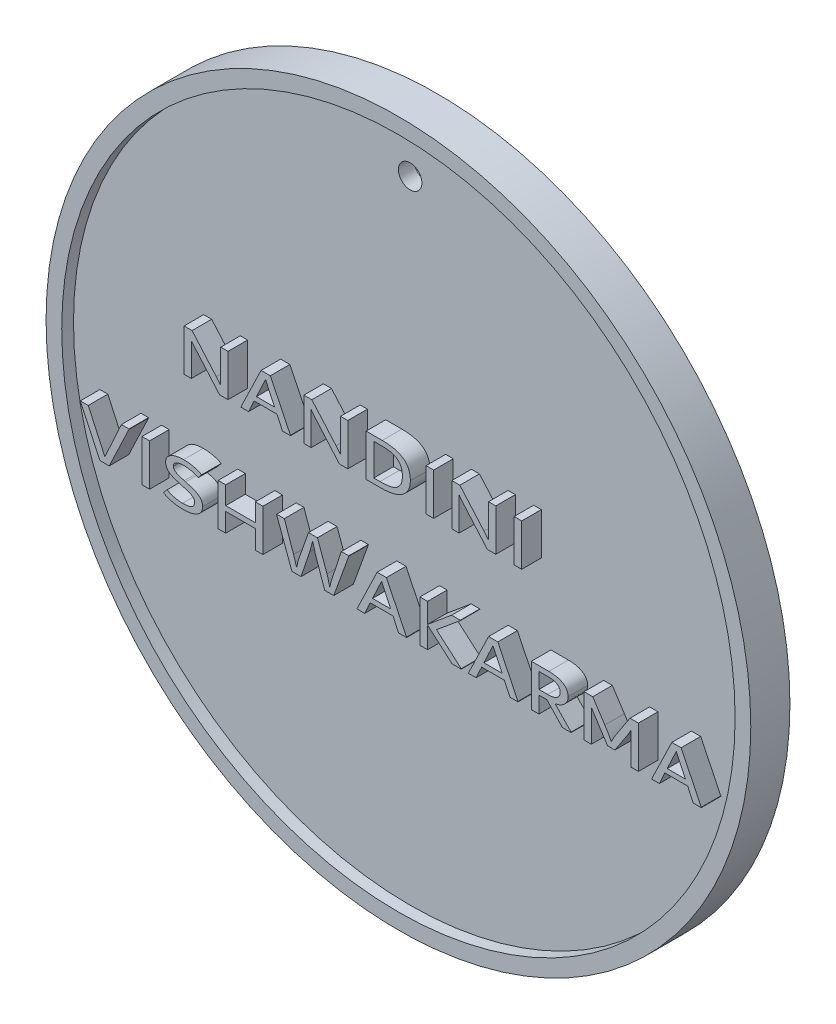
from build123d import *

# Parameters (mm, degrees)
SKETCH1_R           = 45
BOSS_EXTRUDE1_DEPTH = 5
SKETCH2_R           = 43
CUT_EXTRUDE1_DEPTH  = 1.5
CUT_EXTRUDE2_START  = -1.5
SKETCH3_R           = 43
CUT_EXTRUDE2_DEPTH  = 1.5
SKETCH4_R           = 1.5
CUT_EXTRUDE3_DEPTH  = 31.5
SKETCH5_W           = 0.970755601
SKETCH5_H           = 5.348111111
SKETCH5_W_2         = 0.9707556
BOSS_EXTRUDE2_DEPTH = 2.5
BOSS_EXTRUDE3_DEPTH = 2.5
BOSS_EXTRUDE4_DEPTH = 2.5
BOSS_EXTRUDE5_DEPTH = 2.5


with BuildPart() as part:
    # Sketch1 → Boss-Extrude1 (new body)
    with BuildSketch(Plane.XY):
        Circle(SKETCH1_R)
    extrude(amount=BOSS_EXTRUDE1_DEPTH)

    # Sketch2 → Cut-Extrude1 (cut)
    with BuildSketch(Plane.XY.offset(5)):
        Circle(SKETCH2_R)
    extrude(amount=-CUT_EXTRUDE1_DEPTH, mode=Mode.SUBTRACT)

    # Sketch3 → Cut-Extrude2 (cut)
    with BuildSketch(Plane(origin=(0, 0, 0), x_dir=(-1, 0, 0), z_dir=(0, 0, -1)).offset(CUT_EXTRUDE2_START)):
        Circle(SKETCH3_R)
    extrude(amount=CUT_EXTRUDE2_DEPTH, mode=Mode.SUBTRACT)

    # Sketch4 → Cut-Extrude3 (cut)
    with BuildSketch(Plane(origin=(0, 0, 1.5), x_dir=(-1, 0, 0), z_dir=(0, 0, -1))):
        with Locations((0, 37.626935334)):
            Circle(SKETCH4_R)
    extrude(amount=-CUT_EXTRUDE3_DEPTH, mode=Mode.SUBTRACT)

    # Sketch5 → Boss-Extrude2 (add)
    # profile 1 of 18: a face of its own
    with BuildSketch(Plane.XY.offset(3.5)):
        with BuildLine():
            Line((-20.764608658, 9.138884447), (-20.764608658, 3.790773336))
            Line((-20.764608658, 3.790773336), (-21.840439895, 3.790773336))
            Line((-21.840439895, 3.790773336), (-24.84584192, 7.257075313))
            Line((-24.84584192, 7.257075313), (-24.983156672, 7.413494727))
            add(Edge.make_bspline(
                [(-24.983156672, 7.413494727), (-24.98865352, 7.421115212), (-25.002589901, 7.440435737), (-25.030560579, 7.473510844), (-25.069033545, 7.518203573), (-25.134555766, 7.59022804), (-25.215384732, 7.685545356), (-25.304587629, 7.798099887), (-25.38115177, 7.906955024), (-25.425742143, 7.980413154), (-25.447638749, 8.016485598)],
                knots=[0, 0, 0, 0, 0.295690911, 0.749677205, 1.362566065, 2.152279745, 3.814274677, 5.295540138, 6.671944442, 8, 8, 8, 8], degree=3))
            Line((-25.447638749, 8.016485598), (-25.447638749, 3.790773336))
            Line((-25.447638749, 3.790773336), (-26.375408862, 3.790773336))
            Line((-26.375408862, 3.790773336), (-26.375408862, 9.138884447))
            Line((-26.375408862, 9.138884447), (-25.352115443, 9.138884447))
            Line((-25.352115443, 9.138884447), (-22.261936484, 5.598551908))
            add(Edge.make_bspline(
                [(-22.261936484, 5.598551908), (-22.252745791, 5.588235419), (-22.230603419, 5.563380761), (-22.192520328, 5.518391307), (-22.140873016, 5.462045386), (-22.061300057, 5.370533176), (-21.959102763, 5.257039796), (-21.854390292, 5.120625477), (-21.764227376, 4.99558865), (-21.715634088, 4.91158325), (-21.692378771, 4.871380738)],
                knots=[0, 0, 0, 0, 0.358216835, 0.863022034, 1.528040086, 2.33960324, 4.007384369, 5.485359271, 6.79656698, 8, 8, 8, 8], degree=3))
            Line((-21.692378771, 4.871380738), (-21.692378771, 9.138884447))
            Line((-21.692378771, 9.138884447), (-20.764608658, 9.138884447))
        make_face()
    # profile 2 of 18: a face of its own
    with BuildSketch(Plane.XY.offset(3.5)):
        Polygon((-15.361094029, 9.138884447), (-12.787934966, 3.83972903), (-12.787934966, 3.790773336), (-13.800482013, 3.790773336), (-14.518100851, 5.317952195), (-17.429173611, 5.317952195), (-18.134852036, 3.790773336), (-19.105607636, 3.790773336), (-19.105607636, 3.83972903), (-16.543194945, 9.138884447), align=None)
        Polygon((-17.133051361, 5.944823893), (-14.81302906, 5.944823893), (-15.973637231, 8.421265609), align=None, mode=Mode.SUBTRACT)
    # profile 3 of 18: a face of its own
    with BuildSketch(Plane.XY.offset(3.5)):
        with BuildLine():
            Line((-5.465595922, 9.138884447), (-5.465595922, 3.790773336))
            Line((-5.465595922, 3.790773336), (-6.541427159, 3.790773336))
            Line((-6.541427159, 3.790773336), (-9.546829184, 7.257075313))
            Line((-9.546829184, 7.257075313), (-9.684143936, 7.413494727))
            add(Edge.make_bspline(
                [(-9.684143936, 7.413494727), (-9.689640784, 7.421115212), (-9.703577165, 7.440435737), (-9.731547843, 7.473510844), (-9.770020809, 7.518203573), (-9.83554303, 7.59022804), (-9.916371996, 7.685545356), (-10.005574893, 7.798099887), (-10.082139034, 7.906955024), (-10.126729407, 7.980413154), (-10.148626013, 8.016485598)],
                knots=[0, 0, 0, 0, 0.295690911, 0.749677205, 1.362566065, 2.152279745, 3.814274677, 5.295540138, 6.671944442, 8, 8, 8, 8], degree=3))
            Line((-10.148626013, 8.016485598), (-10.148626013, 3.790773336))
            Line((-10.148626013, 3.790773336), (-11.076396126, 3.790773336))
            Line((-11.076396126, 3.790773336), (-11.076396126, 9.138884447))
            Line((-11.076396126, 9.138884447), (-10.053102707, 9.138884447))
            Line((-10.053102707, 9.138884447), (-6.962923748, 5.598551908))
            add(Edge.make_bspline(
                [(-6.962923748, 5.598551908), (-6.953733055, 5.588235419), (-6.931590683, 5.563380761), (-6.893507592, 5.518391307), (-6.84186028, 5.462045386), (-6.762287321, 5.370533176), (-6.660090027, 5.257039796), (-6.555377556, 5.120625477), (-6.46521464, 4.99558865), (-6.416621352, 4.91158325), (-6.393366035, 4.871380738)],
                knots=[0, 0, 0, 0, 0.358216835, 0.863022034, 1.528040086, 2.33960324, 4.007384369, 5.485359271, 6.79656698, 8, 8, 8, 8], degree=3))
            Line((-6.393366035, 4.871380738), (-6.393366035, 9.138884447))
            Line((-6.393366035, 9.138884447), (-5.465595922, 9.138884447))
        make_face()
    # profile 4 of 18: a face of its own
    with BuildSketch(Plane.XY.offset(3.5)):
        with BuildLine():
            add(Edge.make_bspline(
                [(-1.06507601, 9.138884447), (-0.924124935, 9.137250574), (-0.650642045, 9.134080422), (-0.253128749, 9.103956484), (0.118859151, 9.054141793), (0.465918452, 8.986031358), (0.786889974, 8.896536741), (1.082565223, 8.788265092), (1.352841864, 8.659318556), (1.55878938, 8.533354617), (1.710296351, 8.423328696), (1.81442086, 8.333854582), (1.91275644, 8.240313123), (2.002207218, 8.138784762), (2.08671748, 8.033028927), (2.161204765, 7.919155703), (2.229569652, 7.80025308), (2.292098257, 7.676345398), (2.345923897, 7.5452725), (2.391627611, 7.408111437), (2.433172285, 7.26587154), (2.464946945, 7.11692452), (2.489849114, 6.962273566), (2.507728776, 6.801290614), (2.518618498, 6.634733987), (2.519953708, 6.521562436), (2.5206301, 6.464231871)],
                knots=[0, 0, 0, 0, 1.984668711, 3.850789624, 5.609761659, 7.267395322, 8.827241587, 10.297381406, 11.696258534, 13.037254577, 13.690829588, 14.331000493, 14.969205417, 15.600381656, 16.235032469, 16.87395076, 17.514244338, 18.165966119, 18.826925853, 19.507555724, 20.201238236, 20.912540605, 21.650633389, 22.406391424, 23.192708073, 24, 24, 24, 24], degree=3))
            add(Edge.make_bspline(
                [(2.5206301, 6.464231871), (2.519439015, 6.390929089), (2.517096187, 6.246744794), (2.493208104, 6.035774719), (2.458201212, 5.833544378), (2.407009062, 5.640798853), (2.339429363, 5.457935179), (2.259847545, 5.283407131), (2.163623987, 5.119457818), (2.053417474, 4.965070255), (1.92996622, 4.820473724), (1.794664576, 4.685056638), (1.647317488, 4.559877319), (1.488996258, 4.442978298), (1.317932101, 4.3375139), (1.136138574, 4.239954154), (0.941556051, 4.154636548), (0.736758422, 4.077114054), (0.521438928, 4.009202865), (0.296656275, 3.950694303), (0.062205649, 3.90213792), (-0.181200436, 3.861773867), (-0.433654658, 3.829236122), (-0.695381416, 3.806841137), (-0.966630786, 3.793724657), (-1.15063451, 3.791768068), (-1.244182209, 3.790773336)],
                knots=[0, 0, 0, 0, 1.011013638, 1.988632416, 2.925835969, 3.840994547, 4.735740577, 5.612938694, 6.484185894, 7.354324681, 8.226972698, 9.104583291, 9.992715202, 10.892301912, 11.817294138, 12.763162266, 13.736731379, 14.746506294, 15.783394874, 16.850330286, 17.950005295, 19.085769545, 20.253970903, 21.461175459, 22.709258776, 24, 24, 24, 24], degree=3))
            Line((-1.244182209, 3.790773336), (-3.121215178, 3.790773336))
            Line((-3.121215178, 3.790773336), (-3.121215178, 9.138884447))
            Line((-3.121215178, 9.138884447), (-1.06507601, 9.138884447))
        make_face()
        with BuildLine():
            add(Edge.make_bspline(
                [(-1.360004218, 4.434361612), (-1.284372087, 4.434688171), (-1.135845036, 4.43532947), (-0.91808195, 4.444239836), (-0.709784523, 4.456824073), (-0.511426993, 4.475783175), (-0.322353445, 4.501153786), (-0.142682644, 4.530615584), (0.027556602, 4.565008464), (0.188313333, 4.605491612), (0.340485831, 4.652999124), (0.483909595, 4.70886501), (0.618389263, 4.77364946), (0.744145041, 4.846673004), (0.862106331, 4.927869093), (0.970249445, 5.019179496), (1.071786548, 5.116964228), (1.162643586, 5.225207393), (1.24462757, 5.342632215), (1.315121493, 5.47123763), (1.374873537, 5.61043171), (1.423723502, 5.760344205), (1.461815423, 5.921295224), (1.489134804, 6.092888533), (1.504227755, 6.275303277), (1.506774882, 6.400125029), (1.508083054, 6.464231871)],
                knots=[0, 0, 0, 0, 1.34629009, 2.643856423, 3.879167542, 5.060785544, 6.190114824, 7.274566135, 8.301452368, 9.280974057, 10.224389778, 11.13752003, 12.018499389, 12.878894836, 13.724043125, 14.564097332, 15.39583352, 16.230461873, 17.075610163, 17.941356958, 18.83635689, 19.768450087, 20.744583306, 21.777805395, 22.858709518, 24, 24, 24, 24], degree=3))
            add(Edge.make_bspline(
                [(1.508083054, 6.464231871), (1.506519589, 6.548716705), (1.503485361, 6.712677101), (1.472427664, 6.94949296), (1.426108519, 7.16957272), (1.3577812, 7.372101547), (1.269075109, 7.556661526), (1.162153685, 7.725038607), (1.034743608, 7.875250953), (0.886851179, 8.007786496), (0.719593203, 8.124727618), (0.529896037, 8.223306608), (0.320072421, 8.308269083), (0.088458324, 8.376926988), (-0.164326733, 8.430352446), (-0.43852806, 8.467339234), (-0.733867476, 8.492248975), (-0.938054211, 8.494257904), (-1.043583266, 8.495296171)],
                knots=[0, 0, 0, 0, 1.081769288, 2.099398326, 3.054556476, 3.95916122, 4.830368939, 5.671975833, 6.50767675, 7.345288872, 8.20957512, 9.115113505, 10.078092895, 11.105688707, 12.205785687, 13.384814926, 14.648403828, 16, 16, 16, 16], degree=3))
            Line((-1.043583266, 8.495296171), (-2.150459577, 8.495296171))
            Line((-2.150459577, 8.495296171), (-2.150459577, 4.434361612))
            Line((-2.150459577, 4.434361612), (-1.360004218, 4.434361612))
        make_face(mode=Mode.SUBTRACT)
    # profile 5 of 18: a face of its own
    with BuildSketch(Plane.XY.offset(3.5)):
        with Locations((5.013668991, 6.464828892)):
            Rectangle(SKETCH5_W, SKETCH5_H)
    # profile 6 of 18: a face of its own
    with BuildSketch(Plane.XY.offset(3.5)):
        with BuildLine():
            Line((13.432734995, 9.138884447), (13.432734995, 3.790773336))
            Line((13.432734995, 3.790773336), (12.356903758, 3.790773336))
            Line((12.356903758, 3.790773336), (9.351501734, 7.257075313))
            Line((9.351501734, 7.257075313), (9.214186981, 7.413494727))
            add(Edge.make_bspline(
                [(9.214186981, 7.413494727), (9.208690133, 7.421115212), (9.194753752, 7.440435737), (9.166783074, 7.473510844), (9.128310108, 7.518203573), (9.062787887, 7.59022804), (8.981958921, 7.685545356), (8.892756024, 7.798099887), (8.816191883, 7.906955024), (8.77160151, 7.980413154), (8.749704904, 8.016485598)],
                knots=[0, 0, 0, 0, 0.295690911, 0.749677205, 1.362566065, 2.152279745, 3.814274677, 5.295540138, 6.671944442, 8, 8, 8, 8], degree=3))
            Line((8.749704904, 8.016485598), (8.749704904, 3.790773336))
            Line((8.749704904, 3.790773336), (7.821934791, 3.790773336))
            Line((7.821934791, 3.790773336), (7.821934791, 9.138884447))
            Line((7.821934791, 9.138884447), (8.84522821, 9.138884447))
            Line((8.84522821, 9.138884447), (11.935407169, 5.598551908))
            add(Edge.make_bspline(
                [(11.935407169, 5.598551908), (11.944597862, 5.588235419), (11.966740234, 5.563380761), (12.004823325, 5.518391307), (12.056470637, 5.462045386), (12.136043596, 5.370533176), (12.23824089, 5.257039796), (12.342953361, 5.120625477), (12.433116277, 4.99558865), (12.481709565, 4.91158325), (12.504964883, 4.871380738)],
                knots=[0, 0, 0, 0, 0.358216835, 0.863022034, 1.528040086, 2.33960324, 4.007384369, 5.485359271, 6.79656698, 8, 8, 8, 8], degree=3))
            Line((12.504964883, 4.871380738), (12.504964883, 9.138884447))
            Line((12.504964883, 9.138884447), (13.432734995, 9.138884447))
        make_face()
    # profile 7 of 18: a face of its own
    with BuildSketch(Plane.XY.offset(3.5)):
        with Locations((16.26249354, 6.464828892)):
            Rectangle(SKETCH5_W_2, SKETCH5_H)
    # profile 8 of 18: a face of its own
    with BuildSketch(Plane.XY.offset(3.5)):
        Polygon((-34.382172395, -5.769308949), (-33.412610836, -5.769308949), (-33.412610836, -5.818264644), (-35.933232081, -11.11742006), (-37.114138955, -11.11742006), (-39.624013828, -5.818264644), (-39.624013828, -5.769308949), (-38.611466781, -5.769308949), (-36.492043423, -10.391442933), align=None)
    # profile 9 of 18: a face of its own
    with BuildSketch(Plane.XY.offset(3.5)):
        with Locations((-31.262261808, -8.443364504)):
            Rectangle(SKETCH5_W, SKETCH5_H)
    # profile 10 of 18: a face of its own
    with BuildSketch(Plane.XY.offset(3.5)):
        with BuildLine():
            add(Edge.make_bspline(
                [(-26.544723922, -11.216525491), (-26.665399243, -11.214994765), (-26.902391804, -11.211988595), (-27.250398362, -11.1793595), (-27.584435172, -11.130385829), (-27.902975219, -11.059593944), (-28.205168556, -10.971971047), (-28.488863508, -10.86613552), (-28.755344862, -10.747153733), (-28.920795117, -10.65194229), (-29.002060976, -10.60517633)],
                knots=[0, 0, 0, 0, 1.129623678, 2.218452001, 3.269953779, 4.289022632, 5.27141588, 6.213597092, 7.122554579, 8, 8, 8, 8], degree=3))
            Line((-29.002060976, -10.60517633), (-28.5375789, -10.060693485))
            add(Edge.make_bspline(
                [(-28.5375789, -10.060693485), (-28.46583993, -10.102241329), (-28.320822037, -10.186228887), (-28.087326227, -10.288778174), (-27.84137784, -10.377760743), (-27.584148257, -10.447455083), (-27.324628779, -10.503295745), (-27.068996374, -10.542357416), (-26.820659081, -10.567708597), (-26.657419802, -10.571210975), (-26.576963038, -10.572937215)],
                knots=[0, 0, 0, 0, 0.970170809, 1.961167387, 2.981404382, 4.030791623, 5.079350438, 6.088593745, 7.057913252, 8, 8, 8, 8], degree=3))
            add(Edge.make_bspline(
                [(-26.576963038, -10.572937215), (-26.515657599, -10.572175728), (-26.396552684, -10.570696304), (-26.223614312, -10.561426329), (-26.061769805, -10.544985624), (-25.911575106, -10.521033394), (-25.77256323, -10.491818514), (-25.645156107, -10.454850353), (-25.52913698, -10.410505348), (-25.423478341, -10.360916353), (-25.32960824, -10.303916813), (-25.249098034, -10.238713357), (-25.179417526, -10.167750635), (-25.123265608, -10.088668743), (-25.079552195, -10.002474668), (-25.048848599, -9.909904223), (-25.028631708, -9.81041679), (-25.026832235, -9.741590909), (-25.025903352, -9.70606321)],
                knots=[0, 0, 0, 0, 1.478168942, 2.871803656, 4.174303151, 5.398622754, 6.537397196, 7.597254689, 8.593554509, 9.529316819, 10.408238491, 11.234054873, 12.02133356, 12.798901467, 13.562847739, 14.342780878, 15.144548794, 16, 16, 16, 16], degree=3))
            add(Edge.make_bspline(
                [(-25.025903352, -9.70606321), (-25.027153688, -9.665276615), (-25.029575626, -9.586271752), (-25.058328094, -9.474121429), (-25.10237807, -9.372068701), (-25.168394366, -9.28188026), (-25.253499456, -9.199090896), (-25.359572329, -9.121939492), (-25.488212847, -9.049121435), (-25.640735806, -8.978775755), (-25.821425405, -8.907759053), (-26.035152461, -8.835990638), (-26.282839344, -8.757971139), (-26.460964771, -8.708837788), (-26.555470294, -8.682769791)],
                knots=[0, 0, 0, 0, 0.738963051, 1.431393687, 2.088203583, 2.746086341, 3.446281956, 4.237017356, 5.120960833, 6.126551591, 7.284839889, 8.644826234, 10.219892247, 12, 12, 12, 12], degree=3))
            Line((-26.555470294, -8.682769791), (-26.734576493, -8.632620055))
            add(Edge.make_bspline(
                [(-26.734576493, -8.632620055), (-26.840192612, -8.602866515), (-27.041773886, -8.546078245), (-27.327284263, -8.457290431), (-27.580423177, -8.367611066), (-27.805351536, -8.279657796), (-28.004977062, -8.184128442), (-28.181898864, -8.07349423), (-28.339205137, -7.949208789), (-28.454172463, -7.8334978), (-28.535569856, -7.734683242), (-28.586423798, -7.654511485), (-28.629735254, -7.570088465), (-28.665973557, -7.481575469), (-28.693040613, -7.387778142), (-28.713468193, -7.290049453), (-28.725782402, -7.187349721), (-28.726872546, -7.11741594), (-28.727431471, -7.08156037)],
                knots=[0, 0, 0, 0, 1.922887862, 3.670066565, 5.238573659, 6.628350364, 7.901092247, 9.110666912, 10.277328438, 11.406783432, 11.962336937, 12.517627665, 13.066662638, 13.623615524, 14.190825115, 14.774937244, 15.371901213, 16, 16, 16, 16], degree=3))
            add(Edge.make_bspline(
                [(-28.727431471, -7.08156037), (-28.726653721, -7.043691455), (-28.725124072, -6.969212267), (-28.708890375, -6.860077121), (-28.683648515, -6.755420738), (-28.649732457, -6.65485232), (-28.603155017, -6.559809309), (-28.54811087, -6.468343724), (-28.482643122, -6.381344887), (-28.380186958, -6.272295612), (-28.234323082, -6.14627615), (-28.031963985, -6.018492876), (-27.80514518, -5.909610796), (-27.554590807, -5.823210839), (-27.288120166, -5.754660032), (-27.009793619, -5.706272549), (-26.722550146, -5.67515563), (-26.527691139, -5.671869509), (-26.428901913, -5.670203519)],
                knots=[0, 0, 0, 0, 0.607190128, 1.194199212, 1.765720912, 2.333196961, 2.893004062, 3.460300434, 4.043965503, 4.635920748, 5.858433666, 7.124984442, 8.464515155, 9.886360003, 11.370138623, 12.87460512, 14.415493627, 16, 16, 16, 16], degree=3))
            add(Edge.make_bspline(
                [(-26.428901913, -5.670203519), (-26.324967665, -5.671329842), (-26.119203519, -5.673559682), (-25.815595367, -5.698816748), (-25.520008149, -5.736068309), (-25.232579357, -5.791511157), (-24.950320642, -5.862956882), (-24.672322389, -5.954370819), (-24.397506203, -6.064595725), (-24.21975201, -6.153344488), (-24.130372355, -6.197969786)],
                knots=[0, 0, 0, 0, 1.046910887, 2.072625042, 3.067419206, 4.047360001, 5.019962656, 5.998951207, 6.993818112, 8, 8, 8, 8], degree=3))
            Line((-24.130372355, -6.197969786), (-24.573361688, -6.743646673))
            add(Edge.make_bspline(
                [(-24.573361688, -6.743646673), (-24.64941319, -6.707019631), (-24.79865993, -6.635141145), (-25.024582584, -6.543045255), (-25.247187446, -6.467670597), (-25.468712265, -6.406688564), (-25.694908674, -6.360814894), (-25.931477166, -6.329340005), (-26.180944873, -6.307973398), (-26.352038084, -6.306293643), (-26.439648285, -6.305433506)],
                knots=[0, 0, 0, 0, 1.046094911, 2.05290167, 3.021704252, 3.957591456, 4.898975538, 5.879923498, 6.914391002, 8, 8, 8, 8], degree=3))
            add(Edge.make_bspline(
                [(-26.439648285, -6.305433506), (-26.528939267, -6.307052153), (-26.700300161, -6.310158544), (-26.945519452, -6.345963032), (-27.167813958, -6.400360567), (-27.33543462, -6.467071779), (-27.452284723, -6.533500014), (-27.529014359, -6.586703616), (-27.592580792, -6.648628975), (-27.646439823, -6.715786919), (-27.686818881, -6.790414527), (-27.716263895, -6.870769262), (-27.732813227, -6.957500687), (-27.735169288, -7.017412351), (-27.736377168, -7.048127212)],
                knots=[0, 0, 0, 0, 1.928763842, 3.701546226, 5.343777062, 6.867976658, 7.580831405, 8.246930962, 8.879749814, 9.492481583, 10.100848764, 10.705064886, 11.336126718, 12, 12, 12, 12], degree=3))
            add(Edge.make_bspline(
                [(-27.736377168, -7.048127212), (-27.735106678, -7.080096309), (-27.732595562, -7.143283069), (-27.709410097, -7.234912798), (-27.670130606, -7.31966373), (-27.616545246, -7.399882561), (-27.541625391, -7.473930475), (-27.446306829, -7.545386839), (-27.328423538, -7.613842407), (-27.187669053, -7.681072424), (-27.020648986, -7.747837859), (-26.825391466, -7.81651668), (-26.599992551, -7.886443153), (-26.439740932, -7.932435189), (-26.354871351, -7.956792663)],
                knots=[0, 0, 0, 0, 0.649049897, 1.282843906, 1.90554208, 2.540574171, 3.232811908, 4.035394404, 4.956706066, 5.998830161, 7.203729701, 8.611087518, 10.205225098, 12, 12, 12, 12], degree=3))
            Line((-26.354871351, -7.956792663), (-26.175765151, -8.005748358))
            add(Edge.make_bspline(
                [(-26.175765151, -8.005748358), (-26.063724958, -8.036101828), (-25.85081672, -8.093782056), (-25.551059748, -8.186474914), (-25.286239697, -8.273893182), (-25.052374417, -8.359760005), (-24.843709521, -8.455693072), (-24.652731227, -8.567666566), (-24.477924262, -8.700579293), (-24.343540859, -8.824003507), (-24.247197631, -8.933115355), (-24.185304425, -9.021902846), (-24.131726555, -9.115917225), (-24.089276425, -9.21629574), (-24.055431485, -9.322170641), (-24.031813254, -9.433767642), (-24.017132662, -9.551241064), (-24.015423387, -9.631590321), (-24.014550347, -9.672630053)],
                knots=[0, 0, 0, 0, 1.879459929, 3.571508467, 5.079644088, 6.395154746, 7.603290496, 8.793693724, 9.971803905, 11.152819113, 11.742120943, 12.325009232, 12.90216875, 13.491153324, 14.086311322, 14.699379779, 15.335686394, 16, 16, 16, 16], degree=3))
            add(Edge.make_bspline(
                [(-24.014550347, -9.672630053), (-24.015451659, -9.713667534), (-24.017233646, -9.794802844), (-24.031823446, -9.913860577), (-24.055412079, -10.027841126), (-24.089455853, -10.136418915), (-24.131980441, -10.240248042), (-24.185158923, -10.338831891), (-24.247450314, -10.432449865), (-24.319620266, -10.520590465), (-24.399446829, -10.60497949), (-24.489796532, -10.681754354), (-24.586347461, -10.755484887), (-24.692644379, -10.821802899), (-24.805582246, -10.885691688), (-24.928129737, -10.942465586), (-25.058204002, -10.995399126), (-25.246174766, -11.057659741), (-25.498966126, -11.123880501), (-25.824377963, -11.176888618), (-26.17581872, -11.211352382), (-26.418863322, -11.214760564), (-26.544723922, -11.216525491)],
                knots=[0, 0, 0, 0, 0.742014385, 1.46703854, 2.165895887, 2.844399447, 3.522177069, 4.192072169, 4.866899836, 5.552696076, 6.250217458, 6.964657802, 7.694596948, 8.445462713, 9.228556247, 10.040052387, 10.886216757, 11.767185035, 13.619701677, 15.605523065, 17.724320959, 20, 20, 20, 20], degree=3))
        make_face()
    # profile 11 of 18: a face of its own
    with BuildSketch(Plane.XY.offset(3.5)):
        Polygon((-17.280873678, -5.769308949), (-16.311312119, -5.769308949), (-16.311312119, -11.11742006), (-17.280873678, -11.11742006), (-17.280873678, -8.716202948), (-21.056432359, -8.716202948), (-21.056432359, -11.11742006), (-22.027187959, -11.11742006), (-22.027187959, -5.769308949), (-21.056432359, -5.769308949), (-21.056432359, -8.071420631), (-17.280873678, -8.071420631), align=None)
    # profile 12 of 18: a face of its own
    with BuildSketch(Plane.XY.offset(3.5)):
        with BuildLine():
            Line((-5.34475894, -5.769308949), (-5.34475894, -5.818264644))
            Line((-5.34475894, -5.818264644), (-7.254031024, -11.11742006))
            Line((-7.254031024, -11.11742006), (-8.413445154, -11.11742006))
            Line((-8.413445154, -11.11742006), (-9.563306954, -7.832612365))
            add(Edge.make_bspline(
                [(-9.563306954, -7.832612365), (-9.600950076, -7.72137189), (-9.676574694, -7.497891), (-9.779282501, -7.15673762), (-9.872607577, -6.80872514), (-9.926622223, -6.573075791), (-9.953758468, -6.454688672)],
                knots=[0, 0, 0, 0, 0.983379216, 1.975598025, 2.982967191, 4, 4, 4, 4], degree=3))
            add(Edge.make_bspline(
                [(-9.953758468, -6.454688672), (-9.979766548, -6.561025511), (-10.034398288, -6.784393273), (-10.123777295, -7.126738808), (-10.21896029, -7.481389022), (-10.295415583, -7.715905221), (-10.333463611, -7.832612365)],
                knots=[0, 0, 0, 0, 0.918808395, 1.930019511, 2.969872819, 4, 4, 4, 4], degree=3))
            Line((-10.333463611, -7.832612365), (-11.440339923, -11.11742006))
            Line((-11.440339923, -11.11742006), (-12.600948094, -11.11742006))
            Line((-12.600948094, -11.11742006), (-14.552011625, -5.818264644))
            Line((-14.552011625, -5.818264644), (-14.552011625, -5.769308949))
            Line((-14.552011625, -5.769308949), (-13.570509653, -5.769308949))
            Line((-13.570509653, -5.769308949), (-12.389602779, -9.136505496))
            add(Edge.make_bspline(
                [(-12.389602779, -9.136505496), (-12.358533495, -9.225519006), (-12.292909018, -9.413533157), (-12.198157238, -9.713569893), (-12.099212205, -10.045716571), (-12.033480483, -10.27832076), (-11.999151264, -10.399801222)],
                knots=[0, 0, 0, 0, 0.855419187, 1.806814633, 2.854581369, 4, 4, 4, 4], degree=3))
            add(Edge.make_bspline(
                [(-11.999151264, -10.399801222), (-11.986323479, -10.335257721), (-11.961334775, -10.209526081), (-11.919704532, -10.026825184), (-11.881075646, -9.853323052), (-11.840785135, -9.690005492), (-11.798342461, -9.53754062), (-11.758379571, -9.394614035), (-11.716448648, -9.262185671), (-11.687273159, -9.17744511), (-11.673177982, -9.136505496)],
                knots=[0, 0, 0, 0, 1.209463989, 2.356052737, 3.443937625, 4.476576466, 5.447347117, 6.352738064, 7.204179589, 8, 8, 8, 8], degree=3))
            Line((-11.673177982, -9.136505496), (-10.481524736, -5.769308949))
            Line((-10.481524736, -5.769308949), (-9.342409308, -5.769308949))
            Line((-9.342409308, -5.769308949), (-8.129263318, -9.136505496))
            add(Edge.make_bspline(
                [(-8.129263318, -9.136505496), (-8.11802635, -9.169111009), (-8.093706697, -9.239677624), (-8.056473734, -9.354538444), (-8.0175653, -9.487366202), (-7.974700344, -9.63745444), (-7.928092815, -9.805011127), (-7.877695231, -9.9899228), (-7.825569101, -10.193128697), (-7.789721696, -10.334518168), (-7.77105092, -10.408159511)],
                knots=[0, 0, 0, 0, 0.626316473, 1.355507959, 2.192547726, 3.139748713, 4.1902315, 5.351008925, 6.620298523, 8, 8, 8, 8], degree=3))
            add(Edge.make_bspline(
                [(-7.77105092, -10.408159511), (-7.747242583, -10.304854131), (-7.69742548, -10.088695606), (-7.60430092, -9.764304297), (-7.502722239, -9.444478519), (-7.434461217, -9.235569303), (-7.402092149, -9.136505496)],
                knots=[0, 0, 0, 0, 0.960192772, 2.009129164, 3.055938039, 4, 4, 4, 4], degree=3))
            Line((-7.402092149, -9.136505496), (-6.294021796, -5.769308949))
            Line((-6.294021796, -5.769308949), (-5.34475894, -5.769308949))
        make_face()
    # profile 13 of 18: a face of its own
    with BuildSketch(Plane.XY.offset(3.5)):
        Polygon((-0.535876893, -5.769308949), (2.037282171, -11.068464366), (2.037282171, -11.11742006), (1.024735124, -11.11742006), (0.307116285, -9.590241201), (-2.603956474, -9.590241201), (-3.309634899, -11.11742006), (-4.280390499, -11.11742006), (-4.280390499, -11.068464366), (-1.717977808, -5.769308949), align=None)
        Polygon((-2.307834224, -8.963369503), (0.012188077, -8.963369503), (-1.148420094, -6.486927788), align=None, mode=Mode.SUBTRACT)
    # profile 14 of 18: a face of its own
    with BuildSketch(Plane.XY.offset(3.5)):
        Polygon((5.858692039, -8.336497806), (9.021707519, -11.068464366), (9.021707519, -11.11742006), (7.851547016, -11.11742006), (4.719576611, -8.3854535), (4.719576611, -11.11742006), (3.748821011, -11.11742006), (3.748821011, -5.769308949), (4.719576611, -5.769308949), (4.719576611, -8.319781227), (7.788262826, -5.769308949), (8.895139138, -5.769308949), (8.895139138, -5.818264644), align=None)
    # profile 15 of 18: a face of its own
    with BuildSketch(Plane.XY.offset(3.5)):
        Polygon((13.693274813, -5.769308949), (16.266433876, -11.068464366), (16.266433876, -11.11742006), (15.253886829, -11.11742006), (14.536267991, -9.590241201), (11.625195232, -9.590241201), (10.919516806, -11.11742006), (9.948761206, -11.11742006), (9.948761206, -11.068464366), (12.511173897, -5.769308949), align=None)
        Polygon((11.921317481, -8.963369503), (14.241339783, -8.963369503), (13.080731611, -6.486927788), align=None, mode=Mode.SUBTRACT)
    # profile 16 of 18: a face of its own
    with BuildSketch(Plane.XY.offset(3.5)):
        with BuildLine():
            Line((23.050260281, -11.068464366), (23.050260281, -11.11742006))
            Line((23.050260281, -11.11742006), (21.932637597, -11.11742006))
            Line((21.932637597, -11.11742006), (19.961275364, -9.029041777))
            Line((19.961275364, -9.029041777), (18.948728317, -9.029041777))
            Line((18.948728317, -9.029041777), (18.948728317, -11.11742006))
            Line((18.948728317, -11.11742006), (17.977972717, -11.11742006))
            Line((17.977972717, -11.11742006), (17.977972717, -5.769308949))
            Line((17.977972717, -5.769308949), (20.203665753, -5.769308949))
            add(Edge.make_bspline(
                [(20.203665753, -5.769308949), (20.269342523, -5.770202837), (20.397961065, -5.771953388), (20.586820162, -5.779597785), (20.767572313, -5.795659774), (20.941030666, -5.816351329), (21.10648434, -5.845768499), (21.264688653, -5.878118335), (21.414278295, -5.919428905), (21.556460157, -5.965262154), (21.690055315, -6.018829463), (21.817052084, -6.073561186), (21.934188056, -6.136454897), (22.043183278, -6.202700966), (22.142772955, -6.275304302), (22.234980574, -6.350970723), (22.317730621, -6.432820625), (22.392039005, -6.519022981), (22.457999759, -6.609458062), (22.513500977, -6.704607291), (22.563808408, -6.801446618), (22.602936221, -6.903249213), (22.632710991, -7.00888086), (22.654136802, -7.117891747), (22.667641139, -7.230479753), (22.669575596, -7.306798359), (22.670555138, -7.345443503)],
                knots=[0, 0, 0, 0, 1.443492319, 2.826872827, 4.152554518, 5.43060359, 6.664425734, 7.844718874, 8.977817412, 10.07318399, 11.125734732, 12.139971064, 13.110374899, 14.044994234, 14.940824649, 15.816616604, 16.663992096, 17.495094495, 18.315681757, 19.119739271, 19.913839033, 20.711399779, 21.511594246, 22.322992742, 23.15082062, 24, 24, 24, 24], degree=3))
            add(Edge.make_bspline(
                [(22.670555138, -7.345443503), (22.668245583, -7.407701843), (22.663678812, -7.530807607), (22.627651492, -7.711425592), (22.570363406, -7.885134993), (22.488428951, -8.050454924), (22.383836933, -8.206721883), (22.255851763, -8.351998714), (22.105079448, -8.486537173), (21.931223002, -8.609310232), (21.735129496, -8.719424773), (21.515463103, -8.812316179), (21.274020254, -8.890056636), (21.103546595, -8.927393856), (21.015613857, -8.946652925)],
                knots=[0, 0, 0, 0, 0.892395168, 1.764566648, 2.631096222, 3.509355876, 4.402353415, 5.32068414, 6.278821703, 7.294179731, 8.367670416, 9.498063513, 10.709465559, 12, 12, 12, 12], degree=3))
            Line((21.015613857, -8.946652925), (23.050260281, -11.068464366))
        make_face()
        with BuildLine():
            Line((18.948728317, -8.402170079), (20.055604628, -8.402170079))
            add(Edge.make_bspline(
                [(20.055604628, -8.402170079), (20.11969699, -8.401076109), (20.243616818, -8.398960965), (20.42390695, -8.387744427), (20.59156923, -8.365763786), (20.748288509, -8.338098607), (20.892080559, -8.299517583), (21.024956712, -8.254997946), (21.144403448, -8.199472626), (21.252977402, -8.137679941), (21.348841906, -8.067226604), (21.431704123, -7.989313069), (21.502370611, -7.904588557), (21.559744821, -7.812537252), (21.604035792, -7.713532533), (21.636939608, -7.608290501), (21.656142087, -7.495803076), (21.658169005, -7.418353151), (21.659202133, -7.37887666)],
                knots=[0, 0, 0, 0, 1.437422097, 2.779193914, 4.047879113, 5.227779827, 6.344873638, 7.383592262, 8.366027832, 9.293747435, 10.180954304, 11.027026948, 11.83839817, 12.648246151, 13.451178982, 14.264217575, 15.115265779, 16, 16, 16, 16], degree=3))
            add(Edge.make_bspline(
                [(21.659202133, -7.37887666), (21.658180472, -7.340581949), (21.656199589, -7.266332882), (21.637249618, -7.15869664), (21.609166038, -7.05780918), (21.56851963, -6.963298538), (21.513507543, -6.877160775), (21.449405284, -6.796661622), (21.372431632, -6.72389847), (21.283921119, -6.658772715), (21.184497669, -6.599924501), (21.073358263, -6.549926432), (20.951939902, -6.507157127), (20.819229588, -6.47280875), (20.675714087, -6.445131251), (20.520845692, -6.427081779), (20.355122291, -6.414378466), (20.241105829, -6.413401961), (20.182173009, -6.412897225)],
                knots=[0, 0, 0, 0, 0.922114475, 1.787874556, 2.625875553, 3.442071883, 4.256518957, 5.081963471, 5.91649857, 6.800922251, 7.72547823, 8.695587633, 9.733159733, 10.824372084, 11.996407442, 13.252823195, 14.580039466, 16, 16, 16, 16], degree=3))
            Line((20.182173009, -6.412897225), (18.948728317, -6.412897225))
            Line((18.948728317, -6.412897225), (18.948728317, -8.402170079))
        make_face(mode=Mode.SUBTRACT)
    # profile 17 of 18: a face of its own
    with BuildSketch(Plane.XY.offset(3.5)):
        with BuildLine():
            Line((31.650223546, -5.769308949), (31.650223546, -11.11742006))
            Line((31.650223546, -11.11742006), (30.70096069, -11.11742006))
            Line((30.70096069, -11.11742006), (30.70096069, -7.007529807))
            add(Edge.make_bspline(
                [(30.70096069, -7.007529807), (30.673320335, -7.067538522), (30.616621286, -7.190635244), (30.517726308, -7.373415049), (30.409286942, -7.561784909), (30.329719941, -7.686449672), (30.289016432, -7.750223514)],
                knots=[0, 0, 0, 0, 0.932396442, 1.912637928, 2.932183447, 4, 4, 4, 4], degree=3))
            Line((30.289016432, -7.750223514), (28.644821522, -10.250546056))
            Line((28.644821522, -10.250546056), (27.706305038, -10.250546056))
            Line((27.706305038, -10.250546056), (26.091961161, -7.750223514))
            add(Edge.make_bspline(
                [(26.091961161, -7.750223514), (26.047196641, -7.682684368), (25.959427134, -7.550260798), (25.853987087, -7.3854197), (25.776814355, -7.258703717), (25.725791146, -7.171116522), (25.678594351, -7.091911069), (25.651173328, -7.040271615), (25.638225457, -7.015888096)],
                knots=[0, 0, 0, 0, 1.68898918, 3.311590238, 4.078513778, 4.781420606, 5.424601702, 6, 6, 6, 6], degree=3))
            Line((25.638225457, -7.015888096), (25.638225457, -11.11742006))
            Line((25.638225457, -11.11742006), (24.710455344, -11.11742006))
            Line((24.710455344, -11.11742006), (24.710455344, -5.769308949))
            Line((24.710455344, -5.769308949), (25.818525697, -5.769308949))
            Line((25.818525697, -5.769308949), (27.35764497, -8.129928656))
            add(Edge.make_bspline(
                [(27.35764497, -8.129928656), (27.407592142, -8.207017708), (27.504017686, -8.355842022), (27.640301334, -8.573092646), (27.762829422, -8.776219461), (27.874546631, -8.96347408), (27.97262054, -9.136582649), (28.057292794, -9.295103735), (28.129679013, -9.438702102), (28.171450154, -9.530413282), (28.191085817, -9.573524622)],
                knots=[0, 0, 0, 0, 1.321304241, 2.550844689, 3.68885498, 4.733592628, 5.687314713, 6.550487795, 7.318617258, 8, 8, 8, 8], degree=3))
            add(Edge.make_bspline(
                [(28.191085817, -9.573524622), (28.211807792, -9.525197096), (28.255191036, -9.424019244), (28.330342316, -9.269979456), (28.417385889, -9.106889157), (28.514031343, -8.933430775), (28.623185153, -8.749135672), (28.745093691, -8.553324242), (28.88049617, -8.345693017), (28.975434836, -8.203470492), (29.024526665, -8.129928656)],
                knots=[0, 0, 0, 0, 0.755834883, 1.582405639, 2.462886794, 3.413214918, 4.43670549, 5.541759823, 6.728868754, 8, 8, 8, 8], degree=3))
            Line((29.024526665, -8.129928656), (30.574392309, -5.769308949))
            Line((30.574392309, -5.769308949), (31.650223546, -5.769308949))
        make_face()
    # profile 18 of 18: a face of its own
    with BuildSketch(Plane.XY.offset(3.5)):
        Polygon((37.100305787, -5.769308949), (39.67346485, -11.068464366), (39.67346485, -11.11742006), (38.660917804, -11.11742006), (37.943298965, -9.590241201), (35.032226206, -9.590241201), (34.32654778, -11.11742006), (33.35579218, -11.11742006), (33.35579218, -11.068464366), (35.918204872, -5.769308949), align=None)
        Polygon((35.328348455, -8.963369503), (37.648370757, -8.963369503), (36.487762585, -6.486927788), align=None, mode=Mode.SUBTRACT)
    extrude(amount=BOSS_EXTRUDE2_DEPTH)

    # Sketch6 → Boss-Extrude3 (add)
    with BuildSketch(Plane(origin=(0, 0, 1.5), x_dir=(-1, 0, 0), z_dir=(0, 0, -1))):
        with BuildLine():
            Line((-35.184028612, -24.720115911), (-24.662057839, -3.567335991))
            ThreePointArc((-24.662057839, -3.567335991), (-23.345503822, -2.73562434), (-22.000424666, -3.520366854))
            Line((-22.000424666, -3.520366854), (-12.382824627, -21.256686726))
            Line((-12.382824627, -21.256686726), (-10.522922888, -17.517644583))
            ThreePointArc((-10.522922888, -17.517644583), (-9.206368871, -16.685932932), (-7.861289715, -17.470675447))
            Line((-7.861289715, -17.470675447), (-5.808307896, -21.256686726))
            Line((-5.808307896, -21.256686726), (2.990858555, -3.567335991))
            ThreePointArc((2.990858555, -3.567335991), (4.307412572, -2.73562434), (5.652491728, -3.520366854))
            Line((5.652491728, -3.520366854), (13.555595405, -18.094894203))
            Line((13.555595405, -18.094894203), (19.924526585, -8.549964261))
            ThreePointArc((19.924526585, -8.549964261), (21.202461974, -7.882829374), (22.452502904, -8.600872193))
            Line((22.452502904, -8.600872193), (33.591211384, -26.844562163))
            ThreePointArc((33.591211384, -26.844562163), (-1.327623685, -42.979499943), (-35.184028612, -24.720115911))
        make_face()
    extrude(amount=BOSS_EXTRUDE3_DEPTH)

    # Sketch7 → Boss-Extrude4 (add)
    with BuildSketch(Plane(origin=(0, 0, 1.5), x_dir=(-1, 0, 0), z_dir=(0, 0, -1))):
        with BuildLine():
            ThreePointArc((20.910723442, 10.196898557), (25.789247489, 12.888285888), (27.728804957, 18.111472605))
            ThreePointArc((27.728804957, 18.111472605), (22.7254129, 25.530892835), (13.971574051, 23.672927808))
            ThreePointArc((13.971574051, 23.672927808), (24.179163372, 20.404487878), (20.910723442, 10.196898557))
        make_face()
    extrude(amount=BOSS_EXTRUDE4_DEPTH)

    # Sketch8 → Boss-Extrude5 (add)
    with BuildSketch(Plane(origin=(0, 0, 1.5), x_dir=(-1, 0, 0), z_dir=(0, 0, -1))):
        Polygon((-23.938031621, 22.042644953), (-24.396848461, 23.39893508), (-25.800838585, 23.679733105), (-26.74601187, 22.604241003), (-26.287195031, 21.247950876), (-24.883204906, 20.967152851), align=None)
        Polygon((-12.284913589, 31.730176812), (-11.943996253, 33.386074865), (-13.207587365, 34.509266964), (-14.812095813, 33.976561011), (-15.153013148, 32.320662958), (-13.889422036, 31.197470859), align=None)
        Polygon((-12.284913589, 21.504898902), (-12.621466071, 23.163317004), (-14.225974519, 23.701063055), (-15.493930484, 22.580391004), (-15.157378001, 20.921972903), (-13.552869553, 20.384226852), align=None)
        Polygon((5.25669626, 29.844785441), (3.970164819, 31.037073729), (2.294347153, 30.519048962), (1.905060928, 28.808735908), (3.191592368, 27.616447621), (4.867410034, 28.134472387), align=None)
        Polygon((-1.333790618, 19.375063717), (-0.881026744, 20.609179953), (-1.723420819, 21.618343088), (-3.018578768, 21.393389987), (-3.471342641, 20.159273751), (-2.628948567, 19.150110616), align=None)
        Polygon((-10.324865685, 9.125935809), (-11.304889637, 10.823387086), (-13.26493754, 10.823387086), (-14.244961492, 9.125935809), (-13.26493754, 7.428484532), (-11.304889637, 7.428484532), align=None)
        Polygon((-24.883204906, 13.759103219), (-25.126383129, 13.618704207), (-25.126383129, 13.337906182), (-24.883204906, 13.19750717), (-24.640026684, 13.337906182), (-24.640026684, 13.618704207), align=None)
        Polygon((-29.975189156, 8.27721017), (-30.4665857, 9.12833395), (-31.449378787, 9.12833395), (-31.940775331, 8.27721017), (-31.449378787, 7.42608639), (-30.4665857, 7.42608639), align=None)
        Polygon((32.50237138, 19.992121835), (32.615562349, 21.030185563), (31.773168274, 21.647243681), (30.817583231, 21.226238071), (30.704392263, 20.188174343), (31.546786337, 19.571116225), align=None)
        Polygon((32.024578859, 9.125935809), (32.520700562, 9.964079089), (32.04290804, 10.812804728), (31.068993816, 10.823387086), (30.572872113, 9.985243805), (31.050664634, 9.136518167), align=None)
        Polygon((37.396379598, 13.267706676), (37.269455275, 13.90874309), (36.650839294, 14.119341608), (36.159147636, 13.688903713), (36.28607196, 13.047867299), (36.90468794, 12.837268781), align=None)
        Polygon((11.021322477, 13.047867299), (11.155279259, 14.097920175), (10.312885184, 14.738956589), (9.336534327, 14.329940127), (9.202577546, 13.279887251), (10.04497162, 12.638850838), align=None)
        Polygon((3.191592368, 8.27721017), (3.926610332, 8.701572989), (3.926610332, 9.550298628), (3.191592368, 9.974661447), (2.456574404, 9.550298628), (2.456574404, 8.701572989), align=None)
        Polygon((-1.333790618, 3.551061804), (-1.981369592, 4.672701489), (-3.276527541, 4.672701489), (-3.924106515, 3.551061804), (-3.276527541, 2.429422119), (-1.981369592, 2.429422119), align=None)
    extrude(amount=BOSS_EXTRUDE5_DEPTH)


solid = part.part
